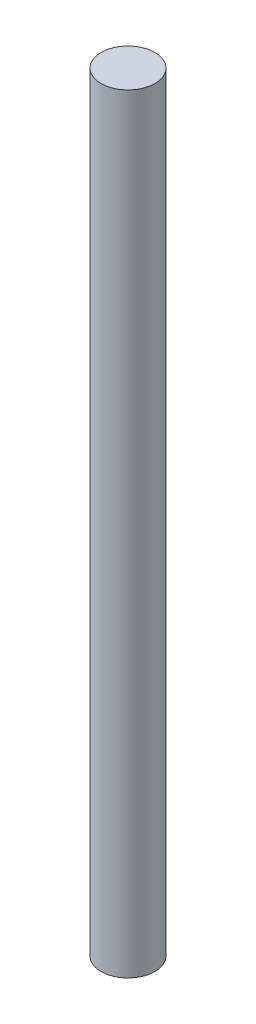
from build123d import *

# Parameters (mm, degrees)
SKETCH_1_R      = 1.4
EXTRUDE_1_DEPTH = 40


with BuildPart() as part:
    # 草图1 → 凸台-拉伸1 (new body)
    with BuildSketch(Plane(origin=(0, 0, 0), x_dir=(1, 0, 0), z_dir=(0, 1, 0))):
        Circle(SKETCH_1_R)
    extrude(amount=EXTRUDE_1_DEPTH)


solid = part.part
